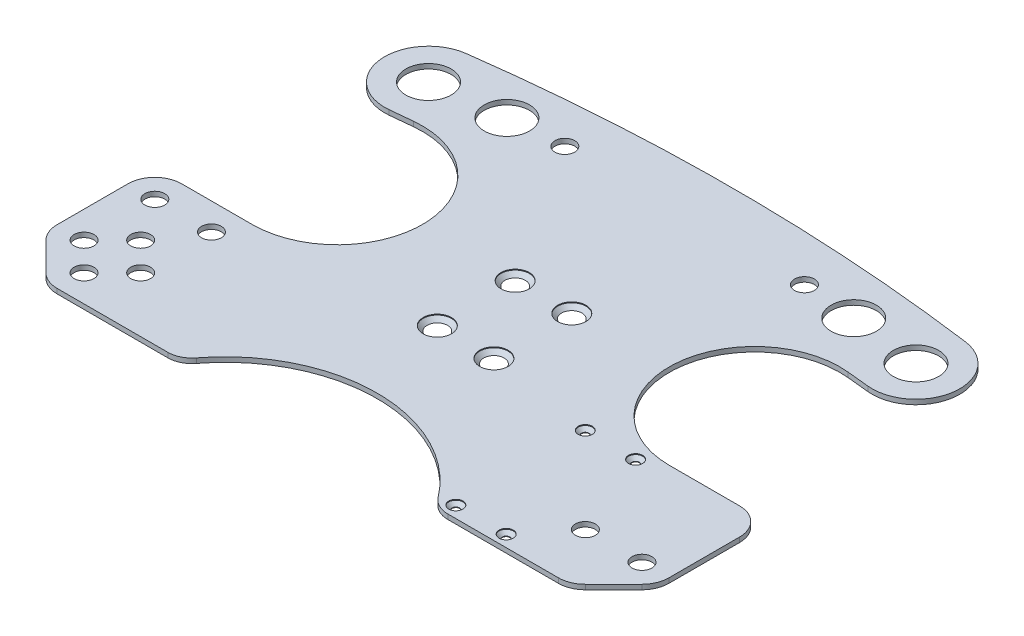
from build123d import *

# Parameters (mm, degrees)
SKETCH1_R                                      = 2.5
BOSS_EXTRUDE1_DEPTH                            = 1.7
CUT_EXTRUDE1_REACH                             = 155.062
SKETCH2_R                                      = 3.5
SKETCH2_R_2                                    = 8
CUT_EXTRUDE2_REACH                             = 155.062
SKETCH3_R                                      = 1.3
FILLET1_R                                      = 8.5
CSK_FOR_M5_FLAT_HEAD_MACHINE_SCREW1_AT_2_COUNT = 2
CSK_FOR_M5_FLAT_HEAD_MACHINE_SCREW1_AT_2_PITCH = 20
CSK_FOR_M5_FLAT_HEAD_MACHINE_SCREW1_AT_3_COUNT = 2
CSK_FOR_M5_FLAT_HEAD_MACHINE_SCREW1_AT_3_PITCH = 34.003676272
CSK_FOR_M5_FLAT_HEAD_MACHINE_SCREW1_AT_4_COUNT = 2
CSK_FOR_M5_FLAT_HEAD_MACHINE_SCREW1_AT_4_PITCH = 27.5
CSK_FOR_M2_5_FLAT_HEAD_MACHINE_SCREW1_AT_COUNT = 2
CSK_FOR_M2_5_FLAT_HEAD_MACHINE_SCREW1_AT_PITCH = 17.78
CSK_FOR_M2_5_FLAT_HEAD_MACHINE_SCREW_2_COUNT   = 2
CSK_FOR_M2_5_FLAT_HEAD_MACHINE_SCREW_2_PITCH   = 49.055548106
CSK_FOR_M2_5_FLAT_HEAD_MACHINE_SCREW_3_COUNT   = 2
CSK_FOR_M2_5_FLAT_HEAD_MACHINE_SCREW_3_PITCH   = 45.72


with BuildPart() as part:
    # Sketch1 → Boss-Extrude1 (new body)
    with BuildSketch(Plane(origin=(0, 0, 0), x_dir=(1, 0, 0), z_dir=(0, 1, 0))):
        with BuildLine():
            Line((-73.314391493, -95), (73.314391493, -95))
            ThreePointArc((73.314391493, -95), (120, 0), (73.314391493, 95))
            Line((73.314391493, 95), (-73.314391493, 95))
            ThreePointArc((-73.314391493, 95), (-120, 0), (-73.314391493, -95))
        make_face()
        with Locations((-10, 13.75)):
            Circle(SKETCH1_R, mode=Mode.SUBTRACT)
        with Locations((-10, -13.75)):
            Circle(SKETCH1_R, mode=Mode.SUBTRACT)
        with Locations((10, -13.75)):
            Circle(SKETCH1_R, mode=Mode.SUBTRACT)
        with Locations((10, 13.75)):
            Circle(SKETCH1_R, mode=Mode.SUBTRACT)
    extrude(amount=BOSS_EXTRUDE1_DEPTH)

    # Sketch2 → Cut-Extrude1 (cut, up to next)
    with BuildSketch(Plane(origin=(0, 1.7, 0), x_dir=(1, 0, 0), z_dir=(0, 1, 0)), mode=Mode.PRIVATE) as cut_extrude1_sk1:
        with Locations((-88.540600769, -40)):
            Circle(SKETCH2_R)
    cut_extrude1_tool1 = extrude(cut_extrude1_sk1.sketch, amount=-CUT_EXTRUDE1_REACH, mode=Mode.PRIVATE) & part.part
    # Sketch2 → Cut-Extrude1 (cut, up to next)
    with BuildSketch(Plane(origin=(0, 1.7, 0), x_dir=(1, 0, 0), z_dir=(0, 1, 0)), mode=Mode.PRIVATE) as cut_extrude1_sk2:
        with Locations((-78.540600769, -50)):
            Circle(SKETCH2_R)
    cut_extrude1_tool2 = extrude(cut_extrude1_sk2.sketch, amount=-CUT_EXTRUDE1_REACH, mode=Mode.PRIVATE) & part.part
    # Sketch2 → Cut-Extrude1 (cut, up to next)
    with BuildSketch(Plane(origin=(0, 1.7, 0), x_dir=(1, 0, 0), z_dir=(0, 1, 0)), mode=Mode.PRIVATE) as cut_extrude1_sk3:
        with Locations((-88.540600769, -60)):
            Circle(SKETCH2_R)
    cut_extrude1_tool3 = extrude(cut_extrude1_sk3.sketch, amount=-CUT_EXTRUDE1_REACH, mode=Mode.PRIVATE) & part.part
    # Sketch2 → Cut-Extrude1 (cut, up to next)
    with BuildSketch(Plane(origin=(0, 1.7, 0), x_dir=(1, 0, 0), z_dir=(0, 1, 0)), mode=Mode.PRIVATE) as cut_extrude1_sk4:
        with Locations((-98.540600769, -50)):
            Circle(SKETCH2_R)
    cut_extrude1_tool4 = extrude(cut_extrude1_sk4.sketch, amount=-CUT_EXTRUDE1_REACH, mode=Mode.PRIVATE) & part.part
    # Sketch2 → Cut-Extrude1 (cut, up to next)
    with BuildSketch(Plane(origin=(0, 1.7, 0), x_dir=(1, 0, 0), z_dir=(0, 1, 0)), mode=Mode.PRIVATE) as cut_extrude1_sk5:
        with Locations((78.540600769, -50)):
            Circle(SKETCH2_R)
    cut_extrude1_tool5 = extrude(cut_extrude1_sk5.sketch, amount=-CUT_EXTRUDE1_REACH, mode=Mode.PRIVATE) & part.part
    # Sketch2 → Cut-Extrude1 (cut, up to next)
    with BuildSketch(Plane(origin=(0, 1.7, 0), x_dir=(1, 0, 0), z_dir=(0, 1, 0)), mode=Mode.PRIVATE) as cut_extrude1_sk6:
        with Locations((98.540600769, -50)):
            Circle(SKETCH2_R)
    cut_extrude1_tool6 = extrude(cut_extrude1_sk6.sketch, amount=-CUT_EXTRUDE1_REACH, mode=Mode.PRIVATE) & part.part
    # Sketch2 → Cut-Extrude1 (cut, up to next)
    with BuildSketch(Plane(origin=(0, 1.7, 0), x_dir=(1, 0, 0), z_dir=(0, 1, 0)), mode=Mode.PRIVATE) as cut_extrude1_sk7:
        with Locations((-98.540600769, -25)):
            Circle(SKETCH2_R)
    cut_extrude1_tool7 = extrude(cut_extrude1_sk7.sketch, amount=-CUT_EXTRUDE1_REACH, mode=Mode.PRIVATE) & part.part
    # Sketch2 → Cut-Extrude1 (cut, up to next)
    with BuildSketch(Plane(origin=(0, 1.7, 0), x_dir=(1, 0, 0), z_dir=(0, 1, 0)), mode=Mode.PRIVATE) as cut_extrude1_sk8:
        with Locations((-78.540600769, -25)):
            Circle(SKETCH2_R)
    cut_extrude1_tool8 = extrude(cut_extrude1_sk8.sketch, amount=-CUT_EXTRUDE1_REACH, mode=Mode.PRIVATE) & part.part
    # Sketch2 → Cut-Extrude1 (cut, up to next)
    with BuildSketch(Plane(origin=(0, 1.7, 0), x_dir=(1, 0, 0), z_dir=(0, 1, 0)), mode=Mode.PRIVATE) as cut_extrude1_sk9:
        with Locations((-86.094520408, 59.228232759)):
            Circle(SKETCH2_R_2)
    cut_extrude1_tool9 = extrude(cut_extrude1_sk9.sketch, amount=-CUT_EXTRUDE1_REACH, mode=Mode.PRIVATE) & part.part
    # Sketch2 → Cut-Extrude1 (cut, up to next)
    with BuildSketch(Plane(origin=(0, 1.7, 0), x_dir=(1, 0, 0), z_dir=(0, 1, 0)), mode=Mode.PRIVATE) as cut_extrude1_sk10:
        with Locations((-61.259580586, 62.084312054)):
            Circle(SKETCH2_R_2)
    cut_extrude1_tool10 = extrude(cut_extrude1_sk10.sketch, amount=-CUT_EXTRUDE1_REACH, mode=Mode.PRIVATE) & part.part
    # Sketch2 → Cut-Extrude1 (cut, up to next)
    with BuildSketch(Plane(origin=(0, 1.7, 0), x_dir=(1, 0, 0), z_dir=(0, 1, 0)), mode=Mode.PRIVATE) as cut_extrude1_sk11:
        with Locations((61.259580586, 62.084312054)):
            Circle(SKETCH2_R_2)
    cut_extrude1_tool11 = extrude(cut_extrude1_sk11.sketch, amount=-CUT_EXTRUDE1_REACH, mode=Mode.PRIVATE) & part.part
    # Sketch2 → Cut-Extrude1 (cut, up to next)
    with BuildSketch(Plane(origin=(0, 1.7, 0), x_dir=(1, 0, 0), z_dir=(0, 1, 0)), mode=Mode.PRIVATE) as cut_extrude1_sk12:
        with Locations((86.094520408, 59.228232759)):
            Circle(SKETCH2_R_2)
    cut_extrude1_tool12 = extrude(cut_extrude1_sk12.sketch, amount=-CUT_EXTRUDE1_REACH, mode=Mode.PRIVATE) & part.part
    # Sketch2 → Cut-Extrude1 (cut, up to next)
    with BuildSketch(Plane(origin=(0, 1.7, 0), x_dir=(1, 0, 0), z_dir=(0, 1, 0)), mode=Mode.PRIVATE) as cut_extrude1_sk13:
        with Locations((-42.320942156, 63.610082158)):
            Circle(SKETCH2_R)
    cut_extrude1_tool13 = extrude(cut_extrude1_sk13.sketch, amount=-CUT_EXTRUDE1_REACH, mode=Mode.PRIVATE) & part.part
    # Sketch2 → Cut-Extrude1 (cut, up to next)
    with BuildSketch(Plane(origin=(0, 1.7, 0), x_dir=(1, 0, 0), z_dir=(0, 1, 0)), mode=Mode.PRIVATE) as cut_extrude1_sk14:
        with Locations((42.320942156, 63.610082158)):
            Circle(SKETCH2_R)
    cut_extrude1_tool14 = extrude(cut_extrude1_sk14.sketch, amount=-CUT_EXTRUDE1_REACH, mode=Mode.PRIVATE) & part.part
    add(cut_extrude1_tool1.solids().sort_by_distance((-88.540601, 1.7, 40))[0], mode=Mode.SUBTRACT)
    add(cut_extrude1_tool2.solids().sort_by_distance((-78.540601, 1.7, 50))[0], mode=Mode.SUBTRACT)
    add(cut_extrude1_tool3.solids().sort_by_distance((-88.540601, 1.7, 60))[0], mode=Mode.SUBTRACT)
    add(cut_extrude1_tool4.solids().sort_by_distance((-98.540601, 1.7, 50))[0], mode=Mode.SUBTRACT)
    add(cut_extrude1_tool5.solids().sort_by_distance((78.540601, 1.7, 50))[0], mode=Mode.SUBTRACT)
    add(cut_extrude1_tool6.solids().sort_by_distance((98.540601, 1.7, 50))[0], mode=Mode.SUBTRACT)
    add(cut_extrude1_tool7.solids().sort_by_distance((-98.540601, 1.7, 25))[0], mode=Mode.SUBTRACT)
    add(cut_extrude1_tool8.solids().sort_by_distance((-78.540601, 1.7, 25))[0], mode=Mode.SUBTRACT)
    add(cut_extrude1_tool9.solids().sort_by_distance((-86.09452, 1.7, -59.228233))[0], mode=Mode.SUBTRACT)
    add(cut_extrude1_tool10.solids().sort_by_distance((-61.259581, 1.7, -62.084312))[0], mode=Mode.SUBTRACT)
    add(cut_extrude1_tool11.solids().sort_by_distance((61.259581, 1.7, -62.084312))[0], mode=Mode.SUBTRACT)
    add(cut_extrude1_tool12.solids().sort_by_distance((86.09452, 1.7, -59.228233))[0], mode=Mode.SUBTRACT)
    add(cut_extrude1_tool13.solids().sort_by_distance((-42.320942, 1.7, -63.610082))[0], mode=Mode.SUBTRACT)
    add(cut_extrude1_tool14.solids().sort_by_distance((42.320942, 1.7, -63.610082))[0], mode=Mode.SUBTRACT)

    # Sketch3 → Cut-Extrude2 (cut, up to next)
    with BuildSketch(Plane(origin=(0, 1.7, 0), x_dir=(1, 0, 0), z_dir=(0, 1, 0)), mode=Mode.PRIVATE) as cut_extrude2_sk1:
        with BuildLine():
            Line((-76.684824467, 44.592702326), (-84.550645906, 43.805313077))
            ThreePointArc((-84.550645906, 43.805313077), (-99.436668511, 51.3391844), (-98.864520746, 68.013282068))
            ThreePointArc((-98.864520746, 68.013282068), (-119.734623685, 7.97620781), (-107.012417284, -54.298642221))
            ThreePointArc((-107.012417284, -54.298642221), (-107.779979993, -52.209948315), (-108.040600769, -50))
            Line((-108.040600769, -50), (-108.040600769, -25))
            ThreePointArc((-108.040600769, -25), (-105.258115191, -18.282485579), (-98.540600769, -15.5))
            Line((-98.540600769, -15.5), (-73.684603715, -15.5))
            ThreePointArc((-73.684603715, -15.5), (-43.600828198, 16.123225329), (-76.684824467, 44.592702326))
        make_face()
    cut_extrude2_tool1 = extrude(cut_extrude2_sk1.sketch, amount=-CUT_EXTRUDE2_REACH, mode=Mode.PRIVATE) & part.part
    # Sketch3 → Cut-Extrude2 (cut, up to next)
    with BuildSketch(Plane(origin=(0, 1.7, 0), x_dir=(1, 0, 0), z_dir=(0, 1, 0)), mode=Mode.PRIVATE) as cut_extrude2_sk2:
        with BuildLine():
            ThreePointArc((-98.864520746, 68.013282068), (-94.209947077, 72.433907674), (-88.163438842, 74.589534022))
            ThreePointArc((-88.163438842, 74.589534022), (2.1e-08, 80.5), (88.163438884, 74.589534017))
            ThreePointArc((88.163438884, 74.589534017), (94.209947407, 72.433907471), (98.864521161, 68.013281465))
            ThreePointArc((98.864521161, 68.013281465), (87.140491363, 82.50172583), (73.314391493, 95))
            Line((73.314391493, 95), (-73.314391493, 95))
            ThreePointArc((-73.314391493, 95), (-87.140491112, 82.501726096), (-98.864520746, 68.013282068))
        make_face()
    cut_extrude2_tool2 = extrude(cut_extrude2_sk2.sketch, amount=-CUT_EXTRUDE2_REACH, mode=Mode.PRIVATE) & part.part
    # Sketch3 → Cut-Extrude2 (cut, up to next)
    with BuildSketch(Plane(origin=(0, 1.7, 0), x_dir=(1, 0, 0), z_dir=(0, 1, 0)), mode=Mode.PRIVATE) as cut_extrude2_sk3:
        with BuildLine():
            ThreePointArc((-105.258115191, -56.717514421), (-106.230963521, -55.577483371), (-107.012417284, -54.298642221))
            ThreePointArc((-107.012417284, -54.298642221), (-92.431540192, -76.527187181), (-73.314391493, -95))
            Line((-73.314391493, -95), (73.314391493, -95))
            ThreePointArc((73.314391493, -95), (92.431540082, -76.527187314), (107.012417128, -54.298642528))
            ThreePointArc((107.012417128, -54.298642528), (106.23096342, -55.57748351), (105.258115191, -56.717514421))
            Line((105.258115191, -56.717514421), (95.258115191, -66.717514421))
            ThreePointArc((95.258115191, -66.717514421), (92.176093377, -68.776855559), (88.540600769, -69.5))
            Line((88.540600769, -69.5), (45.040600769, -69.5))
            ThreePointArc((45.040600769, -69.5), (0, -45), (-45.040600769, -69.5))
            Line((-45.040600769, -69.5), (-88.540600769, -69.5))
            ThreePointArc((-88.540600769, -69.5), (-92.176093377, -68.776855559), (-95.258115191, -66.717514421))
            Line((-95.258115191, -66.717514421), (-105.258115191, -56.717514421))
        make_face()
    cut_extrude2_tool3 = extrude(cut_extrude2_sk3.sketch, amount=-CUT_EXTRUDE2_REACH, mode=Mode.PRIVATE) & part.part
    # Sketch3 → Cut-Extrude2 (cut, up to next)
    with BuildSketch(Plane(origin=(0, 1.7, 0), x_dir=(1, 0, 0), z_dir=(0, 1, 0)), mode=Mode.PRIVATE) as cut_extrude2_sk4:
        with BuildLine():
            Line((84.550645906, 43.805313077), (76.684824467, 44.592702326))
            ThreePointArc((76.684824467, 44.592702326), (43.600828198, 16.123225329), (73.684603715, -15.5))
            Line((73.684603715, -15.5), (98.540600769, -15.5))
            ThreePointArc((98.540600769, -15.5), (105.258115191, -18.282485579), (108.040600769, -25))
            Line((108.040600769, -25), (108.040600769, -50))
            ThreePointArc((108.040600769, -50), (107.779979953, -52.209948483), (107.012417128, -54.298642528))
            ThreePointArc((107.012417128, -54.298642528), (119.734623721, 7.976207273), (98.864521161, 68.013281465))
            ThreePointArc((98.864521161, 68.013281465), (99.436668324, 51.339184085), (84.550645906, 43.805313077))
        make_face()
    cut_extrude2_tool4 = extrude(cut_extrude2_sk4.sketch, amount=-CUT_EXTRUDE2_REACH, mode=Mode.PRIVATE) & part.part
    # Sketch3 → Cut-Extrude2 (cut, up to next)
    with BuildSketch(Plane(origin=(0, 1.7, 0), x_dir=(1, 0, 0), z_dir=(0, 1, 0)), mode=Mode.PRIVATE) as cut_extrude2_sk5:
        with Locations((48.150600769, -19.64)):
            Circle(SKETCH3_R)
    cut_extrude2_tool5 = extrude(cut_extrude2_sk5.sketch, amount=-CUT_EXTRUDE2_REACH, mode=Mode.PRIVATE) & part.part
    # Sketch3 → Cut-Extrude2 (cut, up to next)
    with BuildSketch(Plane(origin=(0, 1.7, 0), x_dir=(1, 0, 0), z_dir=(0, 1, 0)), mode=Mode.PRIVATE) as cut_extrude2_sk6:
        with Locations((65.930600769, -19.64)):
            Circle(SKETCH3_R)
    cut_extrude2_tool6 = extrude(cut_extrude2_sk6.sketch, amount=-CUT_EXTRUDE2_REACH, mode=Mode.PRIVATE) & part.part
    # Sketch3 → Cut-Extrude2 (cut, up to next)
    with BuildSketch(Plane(origin=(0, 1.7, 0), x_dir=(1, 0, 0), z_dir=(0, 1, 0)), mode=Mode.PRIVATE) as cut_extrude2_sk7:
        with Locations((65.930600769, -65.36)):
            Circle(SKETCH3_R)
    cut_extrude2_tool7 = extrude(cut_extrude2_sk7.sketch, amount=-CUT_EXTRUDE2_REACH, mode=Mode.PRIVATE) & part.part
    # Sketch3 → Cut-Extrude2 (cut, up to next)
    with BuildSketch(Plane(origin=(0, 1.7, 0), x_dir=(1, 0, 0), z_dir=(0, 1, 0)), mode=Mode.PRIVATE) as cut_extrude2_sk8:
        with Locations((48.150600769, -65.36)):
            Circle(SKETCH3_R)
    cut_extrude2_tool8 = extrude(cut_extrude2_sk8.sketch, amount=-CUT_EXTRUDE2_REACH, mode=Mode.PRIVATE) & part.part
    add(cut_extrude2_tool1.solids().sort_by_distance((-85.873742, 1.7, -12.710382))[0], mode=Mode.SUBTRACT)
    add(cut_extrude2_tool2.solids().sort_by_distance((0, 1.7, -86.177495))[0], mode=Mode.SUBTRACT)
    add(cut_extrude2_tool3.solids().sort_by_distance((0, 1.7, 75.736765))[0], mode=Mode.SUBTRACT)
    add(cut_extrude2_tool4.solids().sort_by_distance((85.873742, 1.7, -12.710382))[0], mode=Mode.SUBTRACT)
    add(cut_extrude2_tool5.solids().sort_by_distance((48.150601, 1.7, 19.64))[0], mode=Mode.SUBTRACT)
    add(cut_extrude2_tool6.solids().sort_by_distance((65.930601, 1.7, 19.64))[0], mode=Mode.SUBTRACT)
    add(cut_extrude2_tool7.solids().sort_by_distance((65.930601, 1.7, 65.36))[0], mode=Mode.SUBTRACT)
    add(cut_extrude2_tool8.solids().sort_by_distance((48.150601, 1.7, 65.36))[0], mode=Mode.SUBTRACT)

    # Fillet1
    fillet1_edges = [part.edges().sort_by_distance(p)[0] for p in [
        (-45.040600769, 0.85, 69.5),
        (45.040600769, 0.85, 69.5),
    ]]
    fillet(fillet1_edges, radius=FILLET1_R)

    # Sketch5 → CSK for M5 Flat Head Machine Screw1 (revolve, cut)
    with BuildSketch(Plane(origin=(-10, 1.7, -13.75), x_dir=(0, 0, 1), z_dir=(1, 0, 0))):
        Polygon((0, 0), (0, 6.502151548), (2.5, 5), (2.5, 2.8), (5, 0.3), (5, 0), align=None)
    csk_for_m5_flat_head_machine_screw1 = revolve(axis=Axis((-10, 8.05, -13.75), (0, -1, 0)), mode=Mode.SUBTRACT)

    # CSK for M5 Flat Head Machine Screw1 at 2: CSK for M5 Flat Head Machine Screw1 ×2
    with Locations(*[(i * CSK_FOR_M5_FLAT_HEAD_MACHINE_SCREW1_AT_2_PITCH, 0, 0) for i in range(1, CSK_FOR_M5_FLAT_HEAD_MACHINE_SCREW1_AT_2_COUNT)]):
        add(csk_for_m5_flat_head_machine_screw1, mode=Mode.SUBTRACT)

    # CSK for M5 Flat Head Machine Screw1 at 3: CSK for M5 Flat Head Machine Screw1 ×2
    with Locations(*[Vector(0.5881716976750462, 0, 0.8087360843031886) * (i * CSK_FOR_M5_FLAT_HEAD_MACHINE_SCREW1_AT_3_PITCH) for i in range(1, CSK_FOR_M5_FLAT_HEAD_MACHINE_SCREW1_AT_3_COUNT)]):
        add(csk_for_m5_flat_head_machine_screw1, mode=Mode.SUBTRACT)

    # CSK for M5 Flat Head Machine Screw1 at 4: CSK for M5 Flat Head Machine Screw1 ×2
    with Locations(*[(0, 0, i * CSK_FOR_M5_FLAT_HEAD_MACHINE_SCREW1_AT_4_PITCH) for i in range(1, CSK_FOR_M5_FLAT_HEAD_MACHINE_SCREW1_AT_4_COUNT)]):
        add(csk_for_m5_flat_head_machine_screw1, mode=Mode.SUBTRACT)

    # Sketch7 → CSK for M2.5 Flat Head Machine Screw1 (revolve, cut)
    with BuildSketch(Plane(origin=(48.150600769, 1.7, 19.64), x_dir=(0, 0, 1), z_dir=(1, 0, 0))):
        Polygon((0, 0), (0, 5.751075774), (1.25, 5), (1.25, 1.55), (2.5, 0.3), (2.5, 0), align=None)
    csk_for_m2_5_flat_head_machine_screw1 = revolve(axis=Axis((48.150600769, 8.05, 19.64), (0, -1, 0)), mode=Mode.SUBTRACT)

    # CSK for M2.5 Flat Head Machine Screw1 at: CSK for M2.5 Flat Head Machine Screw1 ×2
    with Locations(*[(i * CSK_FOR_M2_5_FLAT_HEAD_MACHINE_SCREW1_AT_PITCH, 0, 0) for i in range(1, CSK_FOR_M2_5_FLAT_HEAD_MACHINE_SCREW1_AT_COUNT)]):
        add(csk_for_m2_5_flat_head_machine_screw1, mode=Mode.SUBTRACT)

    # CSK for M2.5 Flat Head Machine Screw 2: CSK for M2.5 Flat Head Machine Screw1 ×2
    with Locations(*[Vector(0.3624462611549487, 0, 0.9320046715412958) * (i * CSK_FOR_M2_5_FLAT_HEAD_MACHINE_SCREW_2_PITCH) for i in range(1, CSK_FOR_M2_5_FLAT_HEAD_MACHINE_SCREW_2_COUNT)]):
        add(csk_for_m2_5_flat_head_machine_screw1, mode=Mode.SUBTRACT)

    # CSK for M2.5 Flat Head Machine Screw 3: CSK for M2.5 Flat Head Machine Screw1 ×2
    with Locations(*[(0, 0, i * CSK_FOR_M2_5_FLAT_HEAD_MACHINE_SCREW_3_PITCH) for i in range(1, CSK_FOR_M2_5_FLAT_HEAD_MACHINE_SCREW_3_COUNT)]):
        add(csk_for_m2_5_flat_head_machine_screw1, mode=Mode.SUBTRACT)


solid = part.part
